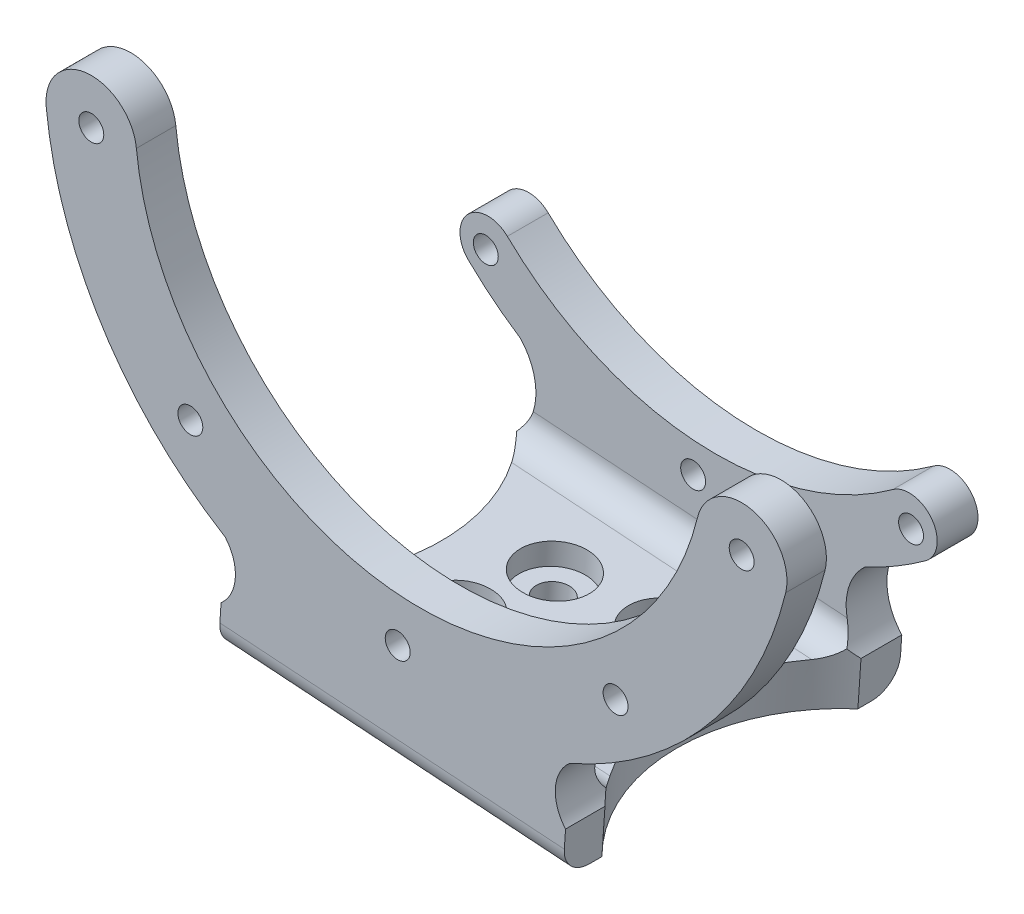
from build123d import *

# Parameters (mm, degrees)
EXTRUDE_2_DEPTH          = 37.1
SKETCH_2_R               = 1.375
CUT_EXTRUDE_2_DEPTH      = 37.1
CUT_EXTRUDE_3_DEPTH      = 43
CUT_EXTRUDE_3_DEPTH_BACK = 66.1
SKETCH_7_W               = 28.25
SKETCH_7_H               = 55.645233233
CUT_EXTRUDE_4_DEPTH      = 20.1
CUT_EXTRUDE_START        = -51.1
CUT_EXTRUDE_5_DEPTH      = 51.1
SKETCH_11_R              = 1.875
CUT_EXTRUDE_11_DEPTH     = 11
SKETCH_14_R              = 3.8
CUT_EXTRUDE_12_DEPTH     = 2.5
CUT_EXTRUDE_13_DEPTH     = 10
CUT_EXTRUDE_START_2      = -4.5
CUT_EXTRUDE_16_DEPTH     = 4.5
FILLET_1_R               = 3
FILLET_2_R               = 3
FILLET_3_R               = 3
FILLET_4_R               = 3


# Read off the part's stored shape, not the designer's step: 切除-拉伸16
with BuildPart() as part:
    # 草图1 → 凸台-拉伸2 (new body)
    with BuildSketch(Plane.XY):
        with BuildLine():
            Line((-79.849997265, 7.517951971), (-80.824006782, -6.607735752))
            Line((-80.824006782, -6.607735752), (-34.011664697, -9.835590396))
            Line((-34.011664697, -9.835590396), (-33.037718089, 4.289184974))
            ThreePointArc((-33.037718089, 4.289184974), (-31.289416401, 5.37750396), (-29.597256671, 6.551212806))
            ThreePointArc((-29.597256671, 6.551212806), (-28.511524827, 13.53842873), (-35.49874075, 14.624160574))
            ThreePointArc((-35.49874075, 14.624160574), (-56.254713351, 8.628523944), (-75.991651506, 17.415521695))
            ThreePointArc((-75.991651506, 17.415521695), (-83.061756308, 17.298825117), (-82.94505973, 10.228720316))
            ThreePointArc((-82.94505973, 10.228720316), (-81.431142485, 8.834956844), (-79.849997265, 7.517951971))
        make_face()
        with BuildLine():
            ThreePointArc((-35.49874075, 14.624160574), (-28.511524827, 13.53842873), (-29.597256671, 6.551212806))
            ThreePointArc((-29.597256671, 6.551212806), (-19.60326972, 16.966618055), (-13.781348513, 30.175163589))
            ThreePointArc((-13.781348513, 30.175163589), (-17.447406903, 36.221651485), (-23.493894799, 32.555593096))
            ThreePointArc((-23.493894799, 32.555593096), (-27.912943426, 22.529829618), (-35.49874075, 14.624160574))
        make_face()
        with BuildLine():
            ThreePointArc((-95.369360777, 35.795593613), (-91.41450046, 21.915219816), (-82.94505973, 10.228720316))
            ThreePointArc((-82.94505973, 10.228720316), (-83.061756308, 17.298825117), (-75.991651506, 17.415521695))
            ThreePointArc((-75.991651506, 17.415521695), (-82.420263145, 26.28599722), (-85.422145072, 36.821702632))
            ThreePointArc((-85.422145072, 36.821702632), (-90.908807434, 41.282255975), (-95.369360777, 35.795593613))
        make_face()
    extrude(amount=EXTRUDE_2_DEPTH)

    # 草图2 → 切除-拉伸2 (cut)
    with BuildSketch(Plane.XY):
        with Locations((-90.395752924, 36.308648122)):
            Circle(SKETCH_2_R)
        with Locations((-79.468355618, 13.822121005)):
            Circle(SKETCH_2_R)
        with Locations((-56.591693385, 3.749865202)):
            Circle(SKETCH_2_R)
        with Locations((-32.547998711, 10.58768669)):
            Circle(SKETCH_2_R)
        with Locations((-18.637621656, 31.365378342)):
            Circle(SKETCH_2_R)
    extrude(amount=CUT_EXTRUDE_2_DEPTH, mode=Mode.SUBTRACT)

    # 草图7 → 切除-拉伸3 (cut, two sides: drawn at the far end of the back side and taken through both)
    with BuildSketch(Plane(origin=(-33.175735668, 2.287568784, 0), x_dir=(0, 0, -1), z_dir=(0.9976311807721483, -0.0687897314369622, 0)).offset(-CUT_EXTRUDE_3_DEPTH_BACK)):
        with Locations((-18.625, 20.670671677)):
            Rectangle(SKETCH_7_W, SKETCH_7_H)
    extrude(amount=CUT_EXTRUDE_3_DEPTH + CUT_EXTRUDE_3_DEPTH_BACK, mode=Mode.SUBTRACT)

    # 草图8 → 切除-拉伸4 (cut)
    with BuildSketch(Plane(origin=(0, 0, 0), x_dir=(-1, 0, 0), z_dir=(0, 0, -1))):
        with BuildLine():
            ThreePointArc((82.94505973, 10.228720316), (51.234404279, 81.455692616), (29.597256671, 6.551212806))
            ThreePointArc((29.597256671, 6.551212806), (28.511524827, 13.53842873), (35.49874075, 14.624160574))
            ThreePointArc((35.49874075, 14.624160574), (51.922117851, 71.47936814), (75.991651506, 17.415521695))
            ThreePointArc((75.991651506, 17.415521695), (83.061756308, 17.298825117), (82.94505973, 10.228720316))
        make_face()
    extrude(amount=-CUT_EXTRUDE_4_DEPTH, mode=Mode.SUBTRACT)

    # 草图9 → 切除-拉伸5 (cut)
    with BuildSketch(Plane.XY.offset(37.1).offset(CUT_EXTRUDE_START)):
        with BuildLine():
            Line((-80.824006782, -6.607735752), (-76.420204424, -6.911391439))
            Line((-76.420204424, -6.911391439), (-76.076255766, -1.923235535))
            ThreePointArc((-76.076255766, -1.923235535), (-74.504863731, 1.236152849), (-75.627746717, 4.581319764))
            ThreePointArc((-75.627746717, 4.581319764), (-77.78440766, 5.984165292), (-79.849997265, 7.517951971))
            Line((-79.849997265, 7.517951971), (-80.824006782, -6.607735752))
        make_face()
        with BuildLine():
            Line((-38.070187243, -4.543870592), (-38.4141359, -9.532026496))
            Line((-38.4141359, -9.532026496), (-34.011664697, -9.835590396))
            Line((-34.011664697, -9.835590396), (-33.037718089, 4.289184974))
            ThreePointArc((-33.037718089, 4.289184974), (-35.293603575, 3.053877922), (-37.621678194, 1.960684706))
            ThreePointArc((-37.621678194, 1.960684706), (-39.193070229, -1.198703677), (-38.070187243, -4.543870592))
        make_face()
    extrude(amount=CUT_EXTRUDE_5_DEPTH, mode=Mode.SUBTRACT)

    # 草图11 → 切除-拉伸11 (cut)
    with BuildSketch(Plane(origin=(-0.491980372, -7.135003276, 0), x_dir=(0.9976311807721483, -0.06878973143696221, 0), z_dir=(0.06878973143696221, 0.9976311807721483, 0))):
        with Locations(Location((-61.324623812, -14.675100208, 0), (0, 0, 180))):
            Circle(SKETCH_11_R)
        with Locations(Location((-62.811349691, -23.836728616, 0), (0, 0, 180))):
            Circle(SKETCH_11_R)
        with Locations(Location((-50.64108112, -13.419201263, 0), (0, 0, 180))):
            Circle(SKETCH_11_R)
        with Locations(Location((-52.106556415, -22.574899792, 0), (0, 0, 180))):
            Circle(SKETCH_11_R)
    extrude(amount=-CUT_EXTRUDE_11_DEPTH, mode=Mode.SUBTRACT)

    # 草图14 → 切除-拉伸12 (cut)
    with BuildSketch(Plane(origin=(-0.491980372, -7.135003276, 0), x_dir=(0.9976311807721483, -0.06878973143696221, 0), z_dir=(0.06878973143696221, 0.9976311807721483, 0))):
        with Locations(Location((-61.324623812, -14.675100208, 0), (0, 0, 180))):
            Circle(SKETCH_14_R)
        with Locations(Location((-50.64108112, -13.419201263, 0), (0, 0, 180))):
            Circle(SKETCH_14_R)
        with Locations(Location((-52.106556415, -22.574899792, 0), (0, 0, 180))):
            Circle(SKETCH_14_R)
        with Locations(Location((-62.811349691, -23.836728616, 0), (0, 0, 180))):
            Circle(SKETCH_14_R)
    extrude(amount=-CUT_EXTRUDE_12_DEPTH, mode=Mode.SUBTRACT)

    # 草图15 → 切除-拉伸13 (cut)
    with BuildSketch(Plane(origin=(-0.491980372, -7.135003276, 0), x_dir=(0.9976311807721483, -0.06878973143696221, 0), z_dir=(0.06878973143696221, 0.9976311807721483, 0))):
        with BuildLine():
            Line((-75.763746013, -4.5), (-75.763746013, -32.75))
            ThreePointArc((-75.763746013, -32.75), (-69.912979444, -18.625), (-75.763746013, -4.5))
        make_face()
        with BuildLine():
            Line((-37.667434214, -4.5), (-37.667434214, -32.75))
            ThreePointArc((-37.667434214, -32.75), (-43.518200782, -18.625), (-37.667434214, -4.5))
        make_face()
    extrude(amount=-CUT_EXTRUDE_13_DEPTH, mode=Mode.SUBTRACT)

    # 切除-拉伸16 outline → 切除-拉伸16 (cut)
    with BuildSketch(Plane(origin=(0, 0, 0), x_dir=(-1, 0, 0), z_dir=(0, 0, -1)).offset(CUT_EXTRUDE_START_2)):
        with BuildLine():
            ThreePointArc((81.380542879, 11.845750626), (78.607973299, 9.405066939), (75.61824487, 7.235826783))
            ThreePointArc((75.61824487, 7.235826783), (73.942295414, 2.862089757), (75.649513236, -1.499537171))
            ThreePointArc((75.649513236, -1.499537171), (74.493972214, 1.536793977), (75.627746717, 4.581319764))
            ThreePointArc((75.627746717, 4.581319764), (79.444122325, 7.200664067), (82.94505973, 10.228720316))
            ThreePointArc((82.94505973, 10.228720316), (83.061756308, 17.298825118), (75.991651506, 17.415521695))
            ThreePointArc((75.991651506, 17.415521695), (56.254713351, 8.628523944), (35.49874075, 14.624160574))
            ThreePointArc((35.49874075, 14.624160574), (28.511524827, 13.538428729), (29.597256671, 6.551212806))
            ThreePointArc((29.597256671, 6.551212806), (33.481243181, 4.031807781), (37.621678194, 1.960684706))
            ThreePointArc((37.621678194, 1.960684706), (39.193070229, -1.198703678), (38.070187243, -4.543870592))
            ThreePointArc((38.070187243, -4.543870592), (39.703483657, 0.033543341), (37.621678194, 4.425178744))
            ThreePointArc((37.621678194, 4.425178744), (34.175575911, 6.230266238), (30.925090589, 8.367626054))
            ThreePointArc((30.925090589, 8.367626054), (30.255194041, 12.678738279), (34.566306266, 13.348634827))
            ThreePointArc((34.566306266, 13.348634827), (56.363372095, 7.052264676), (77.090290005, 16.280007077))
            ThreePointArc((77.090290005, 16.280007077), (81.452544668, 16.208005289), (81.380542879, 11.845750626))
        make_face()
    extrude(amount=CUT_EXTRUDE_16_DEPTH, mode=Mode.SUBTRACT)

    # 圆角1
    # the kernel refuses this fillet: 3 mm, written as the material it adds along each edge
    with BuildSketch(Plane(origin=(-83.558489622, -1.407312549, 32.75), x_dir=(0, 0, -1), z_dir=(0.9976311807721482, -0.06878973143696218, 0))) as fillet_1_piece_1_section:
        with BuildLine():
            CenterArc((FILLET_1_R, FILLET_1_R), FILLET_1_R, 180, 90)
            Line((0, FILLET_1_R), (0, 0))
            Line((0, 0), (FILLET_1_R, 0))
        make_face()
    fillet_1_piece_1 = extrude(amount=53.096311799, mode=Mode.PRIVATE)
    fillet_1_piece_1 = fillet_1_piece_1 - Plane(origin=(-90.121131909, -0.274826283, 18.625), x_dir=(0.7054317730471289, -0.04864168557507743, 0.707106781186547), z_dir=(0.06878973143696221, 0.9976311807721483, 0)) * Cylinder(19.975766569, 119, mode=Mode.PRIVATE)
    fillet_1_piece_1 = fillet_1_piece_1 - Plane(origin=(-23.931982529, -4.838771253, 18.625), x_dir=(-0.7054317730471323, 0.04864168557507767, 0.7071067811865438), z_dir=(0.06878973143696221, 0.9976311807721483, 0)) * Cylinder(19.975766569, 119, mode=Mode.PRIVATE)
    fillet_1_piece_1 = fillet_1_piece_1 - Plane(origin=(-79.104278891, 1.553296639, 32.082260552), x_dir=(0.6567900874720489, -0.7540734586222076, 0), z_dir=(0, 0, -1)) * Cylinder(4.610336213, 119, mode=Mode.PRIVATE)
    fillet_1_piece_1 = fillet_1_piece_1 - Plane(origin=(-34.593655069, -1.515847467, 32.082260552), x_dir=(-0.6567900874720498, 0.754073458622207, 0), z_dir=(0, 0, -1)) * Cylinder(4.610336213, 119, mode=Mode.PRIVATE)
    add(fillet_1_piece_1)

    # 圆角2
    # the kernel refuses this fillet: 3 mm, written as the material it adds along each edge
    with BuildSketch(Plane(origin=(-83.558489622, -1.407312549, 4.5), x_dir=(0, 0, 1), z_dir=(0.9976311807721482, -0.06878973143696218, 0))) as fillet_2_piece_1_section:
        with BuildLine():
            CenterArc((FILLET_2_R, -FILLET_2_R), FILLET_2_R, 90, 90)
            Line((0, -FILLET_2_R), (0, 0))
            Line((0, 0), (FILLET_2_R, 0))
        make_face()
    fillet_2_piece_1 = extrude(amount=53.096311799, mode=Mode.PRIVATE)
    fillet_2_piece_1 = fillet_2_piece_1 - Plane(origin=(-90.121862606, -0.285423301, 18.625), x_dir=(0.7054317730468341, -0.048641685575091055, 0.7071067811868403), z_dir=(0.06878973143700999, 0.997631180772145, 0)) * Cylinder(19.975766569, 119, mode=Mode.PRIVATE)
    fillet_2_piece_1 = fillet_2_piece_1 - Plane(origin=(-23.932713226, -4.849368272, 18.625), x_dir=(-0.7054317730468341, 0.048641685575091055, 0.7071067811868403), z_dir=(0.06878973143700999, 0.997631180772145, 0)) * Cylinder(19.975766569, 119, mode=Mode.PRIVATE)
    fillet_2_piece_1 = fillet_2_piece_1 - Plane(origin=(-33.361408051, -0.283600448, 5.162419383), x_dir=(-0.74154000103131, -0.670908657620756, 0), z_dir=(0, 0, 1)) * Cylinder(6.35000025, 119, mode=Mode.PRIVATE)
    fillet_2_piece_1 = fillet_2_piece_1 - Plane(origin=(-80.426781476, 2.885301072, 5.162419383), x_dir=(0.7415400009547184, 0.670908657705411, 0), z_dir=(0, 0, 1)) * Cylinder(6.484527605, 119, mode=Mode.PRIVATE)
    fillet_2_piece_1 = fillet_2_piece_1 - Plane(origin=(-79.104278891, 1.553296639, 5.162419383), x_dir=(0.6567900874720489, -0.7540734586222076, 0), z_dir=(0, 0, -1)) * Cylinder(4.610336213, 119, mode=Mode.PRIVATE)
    add(fillet_2_piece_1)

    # 圆角3
    fillet_3_edges = [part.edges().sort_by_distance(p)[0] for p in [
        (-57.417170162, -8.221708967, 37.1),
    ]]
    fillet(fillet_3_edges, radius=FILLET_3_R)

    # 圆角4
    fillet_4_edges = [part.edges().sort_by_distance(p)[0] for p in [
        (-57.417170162, -8.221708967, 0),
    ]]
    fillet(fillet_4_edges, radius=FILLET_4_R)


solid = part.part
